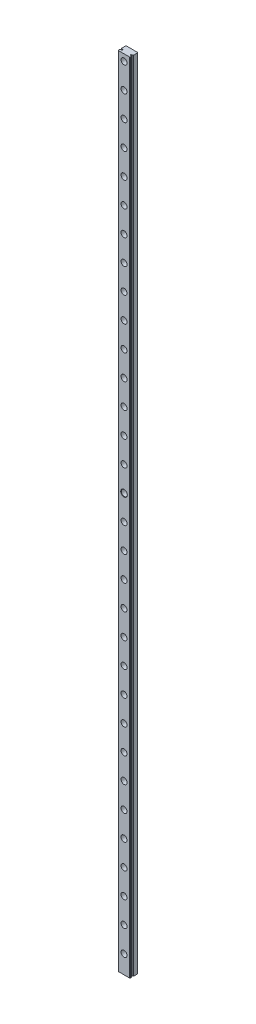
from build123d import *

# Parameters (mm, degrees)
DELKA_DEPTH         = 362.75
BOSS_EXTRUDE1_START = 437.25
BOSS_EXTRUDE1_DEPTH = 437.25
D_RA1_D             = 3.5
D_RA1_CBORE_D       = 6
D_RA1_CBORE_DEPTH   = 4.5
LPATTERN1_COUNT     = 17
LPATTERN1_PITCH     = 25
LPATTERN1_COL_COUNT = 16
LPATTERN1_COL_PITCH = 25


with BuildPart() as part:
    # Skica1 → Delka (new body)
    with BuildSketch(Plane(origin=(0, 0, 0), x_dir=(1, 0, 0), z_dir=(0, 1, 0))):
        with BuildLine():
            Line((-5.5, -8), (5.5, -8))
            Line((5.5, -8), (6, -7.5))
            Line((6, -7.5), (6, -6.661895004))
            ThreePointArc((6, -6.661895004), (5.52983318, -6.420240767), (5.209128789, -6))
            Line((5.209128789, -6), (4, -5.95))
            Line((4, -5.95), (4, -5.05))
            Line((4, -5.05), (5.209128789, -5))
            ThreePointArc((5.209128789, -5), (5.52983318, -4.579759233), (6, -4.338104996))
            Line((6, -4.338104996), (6, -0.5))
            Line((6, -0.5), (5.5, 0))
            Line((5.5, 0), (-1.6, 0))
            ThreePointArc((-1.6, 0), (-2, -0.2), (-2.4, 0))
            Line((-2.4, 0), (-5.5, 0))
            Line((-5.5, 0), (-6, -0.5))
            Line((-6, -0.5), (-6, -4.338104996))
            ThreePointArc((-6, -4.338104996), (-5.52983318, -4.579759233), (-5.209128789, -5))
            Line((-5.209128789, -5), (-4, -5.05))
            Line((-4, -5.05), (-4, -5.95))
            Line((-4, -5.95), (-5.209128789, -6))
            ThreePointArc((-5.209128789, -6), (-5.52983318, -6.420240767), (-6, -6.661895004))
            Line((-6, -6.661895004), (-6, -7.5))
            Line((-6, -7.5), (-5.5, -8))
        make_face()
    extrude(amount=DELKA_DEPTH)

    # Sketch1 → Boss-Extrude1 (add)
    with BuildSketch(Plane.XZ.offset(BOSS_EXTRUDE1_START)):
        with BuildLine():
            Line((6, 6.661895004), (6, 7.5))
            Line((6, 7.5), (5.5, 8))
            Line((5.5, 8), (-5.5, 8))
            Line((-5.5, 8), (-6, 7.5))
            Line((-6, 7.5), (-6, 6.661895004))
            ThreePointArc((-6, 6.661895004), (-5.52983318, 6.420240767), (-5.209128789, 6))
            Line((-5.209128789, 6), (-4, 5.95))
            Line((-4, 5.95), (-4, 5.05))
            Line((-4, 5.05), (-5.209128789, 5))
            ThreePointArc((-5.209128789, 5), (-5.52983318, 4.579759233), (-6, 4.338104996))
            Line((-6, 4.338104996), (-6, 0.5))
            Line((-6, 0.5), (-5.5, 0))
            Line((-5.5, 0), (-2.4, 0))
            ThreePointArc((-2.4, 0), (-2, 0.2), (-1.6, 0))
            Line((-1.6, 0), (5.5, 0))
            Line((5.5, 0), (6, 0.5))
            Line((6, 0.5), (6, 4.338104996))
            ThreePointArc((6, 4.338104996), (5.52983318, 4.579759233), (5.209128789, 5))
            Line((5.209128789, 5), (4, 5.05))
            Line((4, 5.05), (4, 5.95))
            Line((4, 5.95), (5.209128789, 6))
            ThreePointArc((5.209128789, 6), (5.52983318, 6.420240767), (6, 6.661895004))
        make_face()
    extrude(amount=-BOSS_EXTRUDE1_DEPTH)

    # Díra1 (through all)
    with Locations(Plane.XY.offset(8)):
        with Locations((0, -18.875)):
            d_ra1 = CounterBoreHole(D_RA1_D / 2, D_RA1_CBORE_D / 2, D_RA1_CBORE_DEPTH)

    # Zkosení1: read off the stored shape, not the designer's step
    # Zkosení1 outline → Zkosení1 (revolve, cut)
    with BuildSketch(Plane.XZ.offset(18.875)):
        Polygon((2.050001495, -1.495e-06), (1.75, 0.3), (1.75, -1.495e-06), align=None)
        Polygon((3, 8), (3, 7.7), (3.3, 8), align=None)
    revolve(axis=Axis((0, -18.875, 0), (0, 0, 1)), mode=Mode.SUBTRACT)

    # LPattern1: Díra1 ×17
    with Locations(*[(0, -i * LPATTERN1_PITCH, 0) for i in range(1, LPATTERN1_COUNT)]):
        add(d_ra1, mode=Mode.SUBTRACT)

    # LPattern1 col: Díra1 ×16
    with Locations(*[(0, i * LPATTERN1_COL_PITCH, 0) for i in range(1, LPATTERN1_COL_COUNT)]):
        add(d_ra1, mode=Mode.SUBTRACT)


solid = part.part
